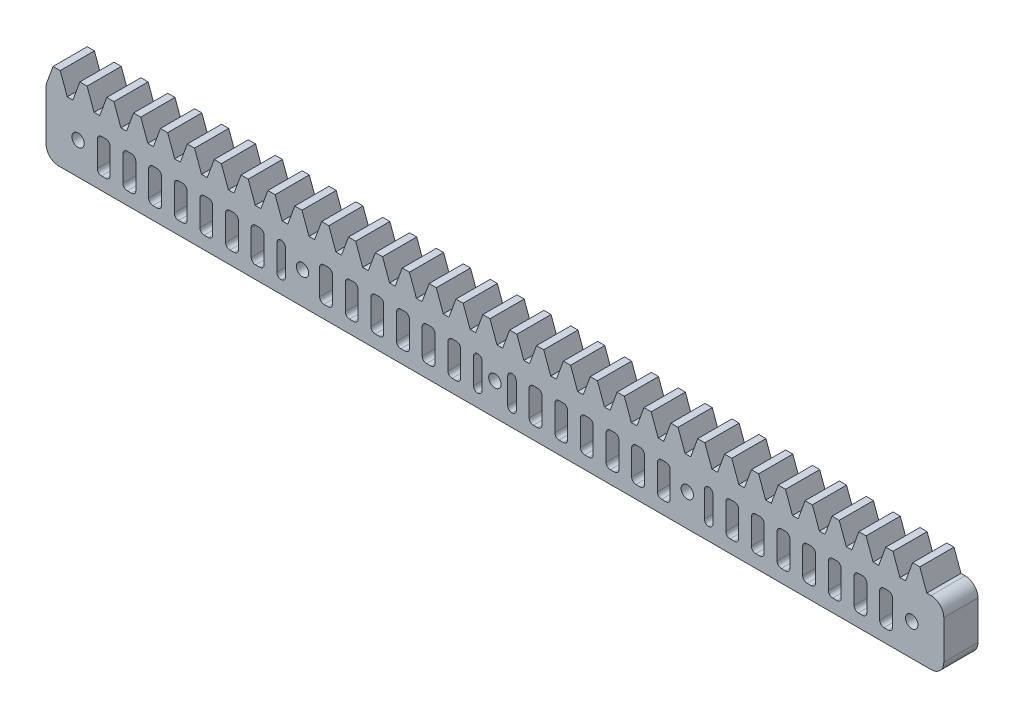
from build123d import *

# Parameters (mm, degrees)
SKETCH_1_W             = 210
SKETCH_1_H             = 10
EXTRUDE_1_DEPTH        = 30
EXTRUDE_2_DEPTH        = 30
PATTERN_LINEAR_1_COUNT = 33
PATTERN_LINEAR_1_PITCH = 6.283185307
SKETCH_5_W             = 389.383450374
SKETCH_5_H             = 75.304943925
CUT_EXTRUDE_1_DEPTH    = 22
SKETCH_6_W             = 210
SKETCH_6_H             = 15
EXTRUDE_1_2_DEPTH      = 8
SKETCH_7_R             = 1.45
CUT_EXTRUDE_2_DEPTH    = 211.686971595
SKETCH_8_R             = 1.45
CUT_EXTRUDE_3_DEPTH    = 211.686971595
SKETCH_9_W             = 44
SKETCH_9_H             = 8
SKETCH_9_W_2           = 38
CUT_EXTRUDE_4_DEPTH    = 211.686971595
SKETCH_10_W            = 3
SKETCH_10_H            = 8
EXTRUDE_2_2_DEPTH      = 8
FILLET_1_R             = 1
FILLET_2_R             = 3


with BuildPart() as part:
    # 草图1 → Extrude 1 (new body)
    with BuildSketch(Plane.XY):
        with Locations((105, -5)):
            Rectangle(SKETCH_1_W, SKETCH_1_H)
    extrude(amount=EXTRUDE_1_DEPTH)

    # 草图2 → Extrude 2 (add)
    with BuildSketch(Plane.XY.offset(30)):
        Polygon((0, 0), (1.637866054, 4.5), (3.323577771, 4.5), (4.961443825, 0), align=None)
    extrude_2 = extrude(amount=-EXTRUDE_2_DEPTH)

    # 阵列(线性)1: Extrude 2 ×33
    with Locations(*[(i * PATTERN_LINEAR_1_PITCH, 0, 0) for i in range(1, PATTERN_LINEAR_1_COUNT)]):
        add(extrude_2)

    # 草图5 → 切除-拉伸1 (cut)
    with BuildSketch(Plane.XY.offset(30)):
        with Locations((181.817615456, -17.423565786)):
            Rectangle(SKETCH_5_W, SKETCH_5_H)
    extrude(amount=-CUT_EXTRUDE_1_DEPTH, mode=Mode.SUBTRACT)

    # 草图6 → Extrude 1 2 (add)
    with BuildSketch(Plane(origin=(0, 0, 0), x_dir=(-1, 0, 0), z_dir=(0, 0, -1))):
        with Locations((-105, -7.5)):
            Rectangle(SKETCH_6_W, SKETCH_6_H)
    extrude(amount=-EXTRUDE_1_2_DEPTH)

    # 草图7 → 切除-拉伸2 (cut, through all)
    with BuildSketch(Plane.XY.offset(8)):
        with Locations((105, -7.5)):
            Circle(SKETCH_7_R)
        with Locations((150, -7.5)):
            Circle(SKETCH_7_R)
        with Locations((60, -7.5)):
            Circle(SKETCH_7_R)
    extrude(amount=-CUT_EXTRUDE_2_DEPTH, mode=Mode.SUBTRACT)

    # 草图8 → 切除-拉伸3 (cut, through all)
    with BuildSketch(Plane(origin=(0, 0, 0), x_dir=(-1, 0, 0), z_dir=(0, 0, -1))):
        with Locations((-202.5, -7.5)):
            Circle(SKETCH_8_R)
        with Locations((-7.5, -7.5)):
            Circle(SKETCH_8_R)
    extrude(amount=-CUT_EXTRUDE_3_DEPTH, mode=Mode.SUBTRACT)

    # 草图9 → 切除-拉伸4 (cut, through all)
    with BuildSketch(Plane(origin=(0, 0, 0), x_dir=(-1, 0, 0), z_dir=(0, 0, -1))):
        with Locations((-176, -8)):
            Rectangle(SKETCH_9_W, SKETCH_9_H)
        with Locations((-127, -8)):
            Rectangle(SKETCH_9_W_2, SKETCH_9_H)
        with Locations((-83, -8)):
            Rectangle(SKETCH_9_W_2, SKETCH_9_H)
        with Locations((-34, -8)):
            Rectangle(SKETCH_9_W, SKETCH_9_H)
    extrude(amount=-CUT_EXTRUDE_4_DEPTH, mode=Mode.SUBTRACT)

    # 草图10 → Extrude 2 2 (add)
    with BuildSketch(Plane(origin=(0, 0, 0), x_dir=(-1, 0, 0), z_dir=(0, 0, -1))):
        with Locations((-193.5, -8)):
            Rectangle(SKETCH_10_W, SKETCH_10_H)
        with Locations((-187.5, -8)):
            Rectangle(SKETCH_10_W, SKETCH_10_H)
        with Locations((-181.5, -8)):
            Rectangle(SKETCH_10_W, SKETCH_10_H)
        with Locations((-175.5, -8)):
            Rectangle(SKETCH_10_W, SKETCH_10_H)
        with Locations((-169.5, -8)):
            Rectangle(SKETCH_10_W, SKETCH_10_H)
        with Locations((-163.5, -8)):
            Rectangle(SKETCH_10_W, SKETCH_10_H)
        with Locations((-157.5, -8)):
            Rectangle(SKETCH_10_W, SKETCH_10_H)
        with Locations((-141.5, -8)):
            Rectangle(SKETCH_10_W, SKETCH_10_H)
        with Locations((-135.5, -8)):
            Rectangle(SKETCH_10_W, SKETCH_10_H)
        with Locations((-129.5, -8)):
            Rectangle(SKETCH_10_W, SKETCH_10_H)
        with Locations((-123.5, -8)):
            Rectangle(SKETCH_10_W, SKETCH_10_H)
        with Locations((-117.5, -8)):
            Rectangle(SKETCH_10_W, SKETCH_10_H)
        with Locations((-111.5, -8)):
            Rectangle(SKETCH_10_W, SKETCH_10_H)
        with Locations((-98.5, -8)):
            Rectangle(SKETCH_10_W, SKETCH_10_H)
        with Locations((-92.5, -8)):
            Rectangle(SKETCH_10_W, SKETCH_10_H)
        with Locations((-86.5, -8)):
            Rectangle(SKETCH_10_W, SKETCH_10_H)
        with Locations((-80.5, -8)):
            Rectangle(SKETCH_10_W, SKETCH_10_H)
        with Locations((-74.5, -8)):
            Rectangle(SKETCH_10_W, SKETCH_10_H)
        with Locations((-68.5, -8)):
            Rectangle(SKETCH_10_W, SKETCH_10_H)
        with Locations((-52.5, -8)):
            Rectangle(SKETCH_10_W, SKETCH_10_H)
        with Locations((-46.5, -8)):
            Rectangle(SKETCH_10_W, SKETCH_10_H)
        with Locations((-40.5, -8)):
            Rectangle(SKETCH_10_W, SKETCH_10_H)
        with Locations((-34.5, -8)):
            Rectangle(SKETCH_10_W, SKETCH_10_H)
        with Locations((-28.5, -8)):
            Rectangle(SKETCH_10_W, SKETCH_10_H)
        with Locations((-22.5, -8)):
            Rectangle(SKETCH_10_W, SKETCH_10_H)
        with Locations((-16.5, -8)):
            Rectangle(SKETCH_10_W, SKETCH_10_H)
    extrude(amount=-EXTRUDE_2_2_DEPTH)

    # 圆角1
    fillet_1_edges = [part.edges().sort_by_distance(p)[0] for p in [
        (195, -12, 4),
        (195, -4, 4),
        (192, -4, 4),
        (192, -12, 4),
        (137, -4, 4),
        (134, -4, 4),
        (134, -12, 4),
        (137, -12, 4),
        (143, -12, 4),
        (143, -4, 4),
        (140, -4, 4),
        (140, -12, 4),
        (159, -12, 4),
        (159, -4, 4),
        (156, -4, 4),
        (156, -12, 4),
        (171, -12, 4),
        (171, -4, 4),
        (168, -4, 4),
        (168, -12, 4),
        (165, -12, 4),
        (165, -4, 4),
        (162, -4, 4),
        (162, -12, 4),
        (177, -12, 4),
        (177, -4, 4),
        (174, -4, 4),
        (174, -12, 4),
        (183, -12, 4),
        (183, -4, 4),
        (180, -4, 4),
        (180, -12, 4),
        (189, -12, 4),
        (189, -4, 4),
        (186, -4, 4),
        (186, -12, 4),
        (79, -4, 4),
        (79, -12, 4),
        (82, -12, 4),
        (82, -4, 4),
        (85, -4, 4),
        (85, -12, 4),
        (88, -12, 4),
        (88, -4, 4),
        (91, -4, 4),
        (91, -12, 4),
        (94, -12, 4),
        (94, -4, 4),
        (113, -4, 4),
        (110, -4, 4),
        (110, -12, 4),
        (113, -12, 4),
        (97, -4, 4),
        (97, -12, 4),
        (100, -12, 4),
        (100, -4, 4),
        (131, -4, 4),
        (128, -4, 4),
        (128, -12, 4),
        (131, -12, 4),
        (125, -4, 4),
        (122, -4, 4),
        (122, -12, 4),
        (125, -12, 4),
        (119, -4, 4),
        (116, -4, 4),
        (116, -12, 4),
        (119, -12, 4),
        (73, -4, 4),
        (73, -12, 4),
        (76, -12, 4),
        (76, -4, 4),
        (70, -4, 4),
        (67, -4, 4),
        (67, -12, 4),
        (70, -12, 4),
        (54, -4, 4),
        (51, -4, 4),
        (51, -12, 4),
        (54, -12, 4),
        (48, -4, 4),
        (45, -4, 4),
        (45, -12, 4),
        (48, -12, 4),
        (42, -4, 4),
        (39, -4, 4),
        (39, -12, 4),
        (42, -12, 4),
        (36, -4, 4),
        (33, -4, 4),
        (33, -12, 4),
        (36, -12, 4),
        (30, -4, 4),
        (27, -4, 4),
        (27, -12, 4),
        (30, -12, 4),
        (24, -4, 4),
        (21, -4, 4),
        (21, -12, 4),
        (24, -12, 4),
        (18, -4, 4),
        (15, -4, 4),
        (15, -12, 4),
        (18, -12, 4),
        (154, -4, 4),
        (154, -12, 4),
        (198, -12, 4),
        (198, -4, 4),
        (108, -4, 4),
        (108, -12, 4),
        (146, -12, 4),
        (146, -4, 4),
        (102, -4, 4),
        (64, -4, 4),
        (64, -12, 4),
        (102, -12, 4),
        (12, -4, 4),
        (12, -12, 4),
        (56, -12, 4),
        (56, -4, 4),
    ]]
    fillet(fillet_1_edges, radius=FILLET_1_R - 0.0001)  # a hair under: the kernel refuses the full size

    # 圆角2
    fillet_2_edges = [part.edges().sort_by_distance(p)[0] for p in [
        (0, 0, 4),
        (0, -15, 4),
        (210, -15, 4),
        (210, 0, 4),
    ]]
    fillet(fillet_2_edges, radius=FILLET_2_R)


solid = part.part
